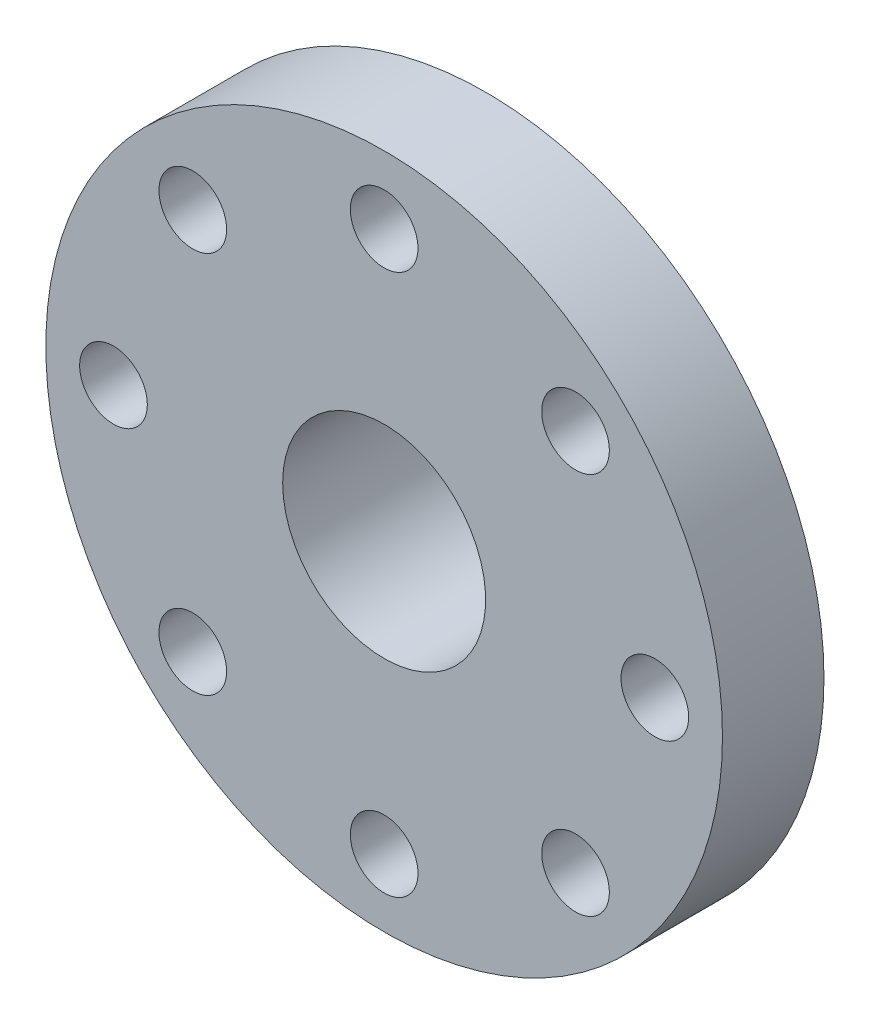
from build123d import *

# Parameters (mm, degrees)
SKETCH_1_R          = 10
SKETCH_1_R_2        = 1.5
SKETCH_1_R_3        = 1
EXTRUDE_1_DEPTH     = 3
SKETCH_2_R          = 5
EXTRUDE_2_DEPTH     = 2
SKETCH_3_R          = 3
CUT_EXTRUDE_1_DEPTH = 16


with BuildPart() as part:
    # 草图1 → 凸台-拉伸1 (new body)
    with BuildSketch(Plane.XY):
        Circle(SKETCH_1_R)
        Circle(SKETCH_1_R_2, mode=Mode.SUBTRACT)
        with Locations((0, 8)):
            Circle(SKETCH_1_R_3, mode=Mode.SUBTRACT)
        with Locations((5.656854249, 5.656854249)):
            Circle(SKETCH_1_R_3, mode=Mode.SUBTRACT)
        with Locations((8, 0)):
            Circle(SKETCH_1_R_3, mode=Mode.SUBTRACT)
        with Locations((5.656854249, -5.656854249)):
            Circle(SKETCH_1_R_3, mode=Mode.SUBTRACT)
        with Locations((0, -8)):
            Circle(SKETCH_1_R_3, mode=Mode.SUBTRACT)
        with Locations((-5.656854249, -5.656854249)):
            Circle(SKETCH_1_R_3, mode=Mode.SUBTRACT)
        with Locations((-8, 0)):
            Circle(SKETCH_1_R_3, mode=Mode.SUBTRACT)
        with Locations((-5.656854249, 5.656854249)):
            Circle(SKETCH_1_R_3, mode=Mode.SUBTRACT)
    extrude(amount=EXTRUDE_1_DEPTH)

    # 草图2 → 凸台-拉伸2 (add)
    with BuildSketch(Plane(origin=(0, 0, 0), x_dir=(-1, 0, 0), z_dir=(0, 0, -1))):
        Circle(SKETCH_2_R)
    extrude(amount=EXTRUDE_2_DEPTH)

    # 草图3 → 切除-拉伸1 (cut, through all)
    with BuildSketch(Plane(origin=(0, 0, -2), x_dir=(-1, 0, 0), z_dir=(0, 0, -1))):
        Circle(SKETCH_3_R)
    extrude(amount=-CUT_EXTRUDE_1_DEPTH, mode=Mode.SUBTRACT)


solid = part.part
